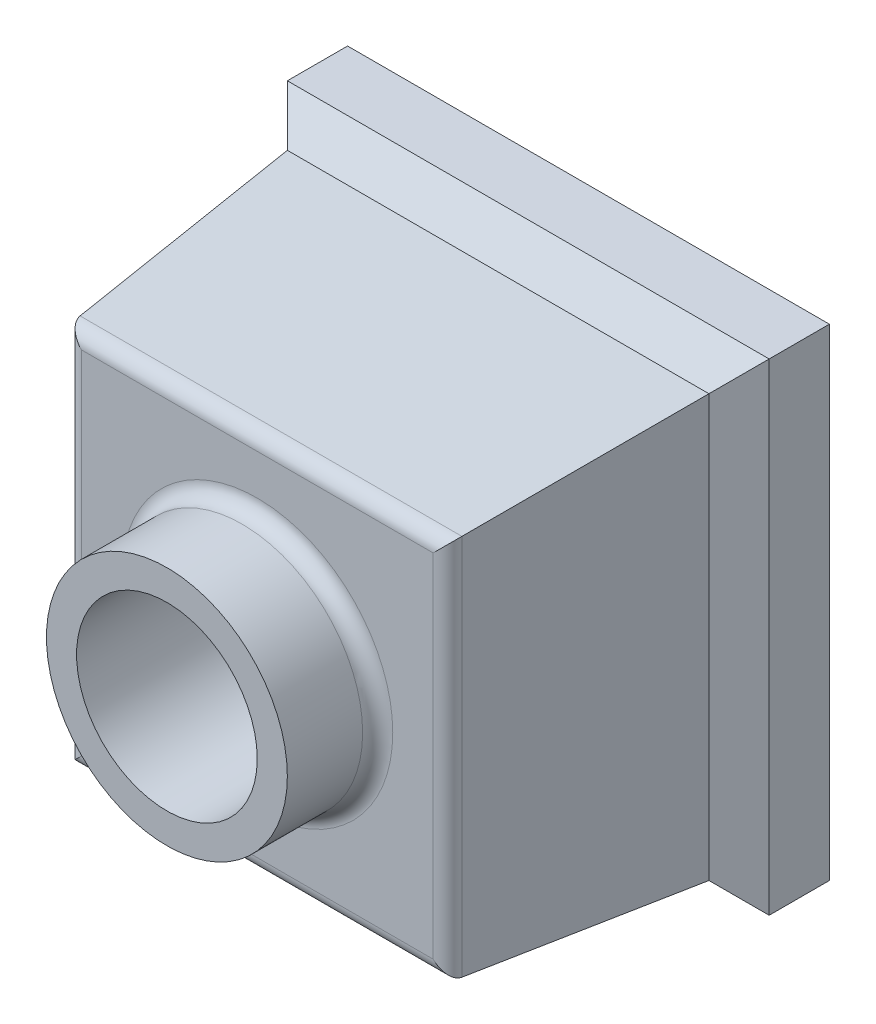
from build123d import *

# Parameters (mm, degrees)
SKETCH1_W               = 160
SKETCH1_H               = 160
BOSS_EXTRUDE1_DEPTH     = 30
SKETCH2_W               = 140
SKETCH2_H               = 140
BOSS_EXTRUDE2_DEPTH     = 80
BOSS_EXTRUDE2_TAPER     = 5
SKETCH3_R               = 40
BOSS_EXTRUDE3_DEPTH     = 30
CUT_EXTRUDE1_DEPTH      = 267.082693913
CUT_EXTRUDE1_DEPTH_BACK = 267.082693913
SKETCH4_R               = 30
FILLET1_R               = 5
CHAMFER1_SIZE           = 10


with BuildPart() as part:
    # Sketch1 → Boss-Extrude1 (new body)
    with BuildSketch(Plane.XY):
        with Locations((80, 80)):
            Rectangle(SKETCH1_W, SKETCH1_H)
    extrude(amount=BOSS_EXTRUDE1_DEPTH)

    # Sketch2 → Boss-Extrude2 (add)
    with BuildSketch(Plane.XY.offset(30)):
        with Locations((80, 80)):
            Rectangle(SKETCH2_W, SKETCH2_H)
    extrude(amount=BOSS_EXTRUDE2_DEPTH, taper=BOSS_EXTRUDE2_TAPER)

    # Sketch3 → Boss-Extrude3 (add)
    with BuildSketch(Plane.XY.offset(110)):
        with Locations((80, 80)):
            Circle(SKETCH3_R)
    extrude(amount=BOSS_EXTRUDE3_DEPTH)

    # Sketch4 → Cut-Extrude1 (cut, two sides: drawn at the far end of the back side and taken through both)
    with BuildSketch(Plane.XY.offset(140).offset(-CUT_EXTRUDE1_DEPTH_BACK)):
        with Locations((80, 80)):
            Circle(SKETCH4_R)
    extrude(amount=CUT_EXTRUDE1_DEPTH + CUT_EXTRUDE1_DEPTH_BACK, mode=Mode.SUBTRACT)

    # Fillet1
    fillet1_edges = [part.edges().sort_by_distance(p)[0] for p in [
        (16.999093082, 80, 110),
        (80, 16.999093082, 110),
        (143.000906918, 80, 110),
        (80, 143.000906918, 110),
        (40, 80, 110),
    ]]
    fillet(fillet1_edges, radius=FILLET1_R)

    # Chamfer1
    chamfer1_edges = [part.edges().sort_by_distance(p)[0] for p in [
        (160, 80, 30),
        (80, 160, 30),
        (0, 80, 30),
        (80, 0, 30),
    ]]
    chamfer(chamfer1_edges, length=CHAMFER1_SIZE - 0.0001)  # a hair under: the kernel refuses the full size


solid = part.part
